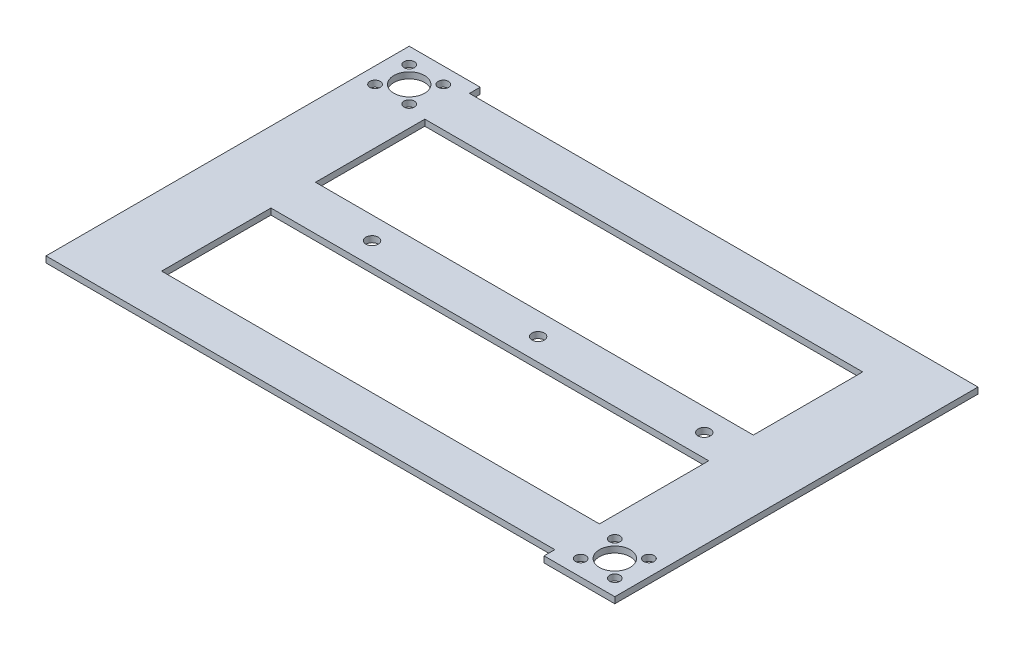
from build123d import *

# Parameters (mm, degrees)
SKETCH1_R           = 5
SKETCH1_R_2         = 1.7
SKETCH1_R_3         = 2
SKETCH1_W           = 142.3736446
SKETCH1_H           = 35.551129401
SKETCH1_H_2         = 35.551129402
BOSS_EXTRUDE1_DEPTH = 2


with BuildPart() as part:
    # Sketch1 → Boss-Extrude1 (new body)
    with BuildSketch(Plane(origin=(0, 0, 0), x_dir=(1, 0, 0), z_dir=(0, 1, 0))):
        Polygon((67.730491212, 150.133829438), (82.230491212, 150.133829438), (85.730491212, 150.133829438), (85.730491212, 100.082700036), (85.730491212, 85.582700036), (85.730491212, 50.031570635), (85.730491212, 32.031570635), (67.730491212, 32.031570635), (62.730491212, 32.031570635), (62.730491212, 35.531570635), (-84.727026002, 35.531570635), (-99.227026002, 35.531570635), (-102.727026002, 35.531570635), (-102.727026002, 85.582700036), (-102.727026002, 100.082700036), (-102.727026002, 153.633829438), (-84.643153388, 153.633829438), (-79.643153388, 153.633829438), (-79.643153388, 153.432122466), (-79.643153388, 150.133829438), align=None)
        with Locations((-91.977026002, 142.883829438)):
            Circle(SKETCH1_R, mode=Mode.SUBTRACT)
        with Locations((74.980491212, 42.781570635)):
            Circle(SKETCH1_R, mode=Mode.SUBTRACT)
        with Locations((-86.427026002, 148.433829438)):
            Circle(SKETCH1_R_2, mode=Mode.SUBTRACT)
        with Locations((-97.527026002, 148.433829438)):
            Circle(SKETCH1_R_2, mode=Mode.SUBTRACT)
        with Locations((-86.427026002, 137.333829438)):
            Circle(SKETCH1_R_2, mode=Mode.SUBTRACT)
        with Locations((-97.527026002, 137.333829438)):
            Circle(SKETCH1_R_2, mode=Mode.SUBTRACT)
        with Locations((69.430491212, 48.331570635)):
            Circle(SKETCH1_R_2, mode=Mode.SUBTRACT)
        with Locations((80.530491212, 48.331570635)):
            Circle(SKETCH1_R_2, mode=Mode.SUBTRACT)
        with Locations((80.530491212, 37.231570635)):
            Circle(SKETCH1_R_2, mode=Mode.SUBTRACT)
        with Locations((69.430491212, 37.231570635)):
            Circle(SKETCH1_R_2, mode=Mode.SUBTRACT)
        with Locations((-54, 92.833829438)):
            Circle(SKETCH1_R_3, mode=Mode.SUBTRACT)
        with Locations((0, 92.833829438)):
            Circle(SKETCH1_R_3, mode=Mode.SUBTRACT)
        with Locations((54, 92.833829438)):
            Circle(SKETCH1_R_3, mode=Mode.SUBTRACT)
        with Locations((-8.456331088, 67.807135336)):
            Rectangle(SKETCH1_W, SKETCH1_H, mode=Mode.SUBTRACT)
        with Locations((-8.456331088, 117.858264737)):
            Rectangle(SKETCH1_W, SKETCH1_H_2, mode=Mode.SUBTRACT)
    extrude(amount=BOSS_EXTRUDE1_DEPTH)


solid = part.part
